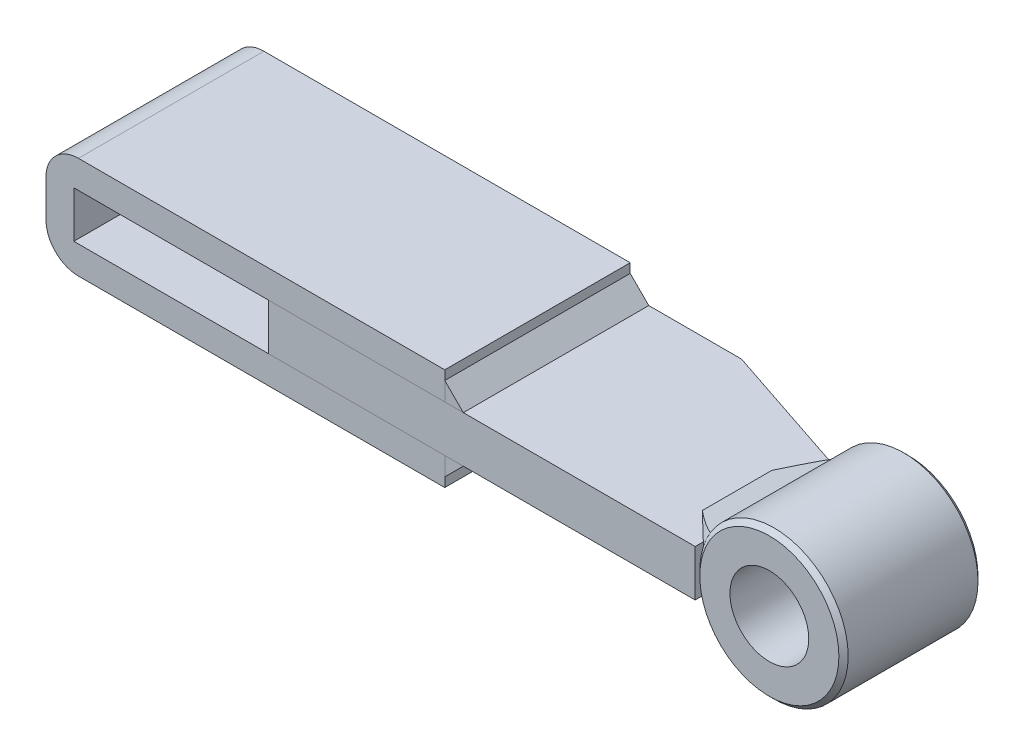
from build123d import *
from OCP.BRepAlgoAPI import BRepAlgoAPI_Cut
from OCP.TopTools import TopTools_ListOfShape

# Parameters (mm, degrees)
P_IDAT_VYSUNUT_M1_DEPTH     = 5
VYSUNOUT_TENKOST_NN_1_DEPTH = 20
ZAOBLIT1_R                  = 3.5
SKICA3_R                    = 8
P_IDAT_VYSUNUT_M2_DEPTH     = 15
SKICA7_W                    = 4.25
SKICA7_H                    = 15.001
ZKOSEN_1_SIZE               = 0.5
KOUTOV_START                = -20
KOUTOV_SVAR_1_DEPTH         = 20
KOUTOV_SVAR_1_2_DEPTH       = 20
KOUTOV_START_2              = -12.784168981
KOUTOV_SVAR_2_DEPTH         = 10.568338072
KOUTOV_START_3              = -14.500001194
KOUTOV_SVAR_2_2_DEPTH       = 14.000001194
KOUTOV_SVAR_2_3_ANGLE       = 14.364836
KOUTOV_START_4              = -11.243553316
KOUTOV_SVAR_5_DEPTH         = 7.487106972
KOUTOV_START_5              = -14.500007293
KOUTOV_SVAR_5_2_DEPTH       = 14.000007293
KOUTOV_SVAR_5_3_ANGLE       = 17.987423


with BuildPart() as part:
    # Skica1 → Přidat vysunutím1 (new body)
    with BuildSketch(Plane(origin=(0, 0, 0), x_dir=(1, 0, 0), z_dir=(0, 1, 0))):
        Polygon((0, 0), (0, 20), (31, 20), (46, 15), (46, 0), align=None)
    extrude(amount=P_IDAT_VYSUNUT_M1_DEPTH)


with BuildPart() as body_2:
    # Skica2 → Vysunout tenkostěnný1 (new body)
    with BuildSketch(Plane.XY):
        Polygon((19, 5), (-21, 5), (-21, 0), (19, 0), (19, -3), (-24, -3), (-24, 8), (19, 8), align=None)
    extrude(amount=-VYSUNOUT_TENKOST_NN_1_DEPTH)

    # Zaoblit1
    zaoblit1_edges = [body_2.edges().sort_by_distance(p)[0] for p in [
        (-24, -3, -10),
        (-24, 8, -10),
    ]]
    fillet(zaoblit1_edges, radius=ZAOBLIT1_R)


with BuildPart() as body_3:
    # Skica3 → Přidat vysunutím2 (new body)
    with BuildSketch(Plane.XY):
        with Locations((54, 2.5)):
            Circle(SKICA3_R)
    extrude(amount=-P_IDAT_VYSUNUT_M2_DEPTH)

    # Skica7 → M10 závit1 (revolve, cut)
    with BuildSketch(Plane(origin=(54, 2.5, 0), x_dir=(0, -1, 0), z_dir=(1, 0, 0))):
        with Locations((2.125, 7.5005)):
            Rectangle(SKICA7_W, SKICA7_H)
    revolve(axis=Axis((54, 2.5, 6.35), (0, 0, -1)), mode=Mode.SUBTRACT)

    # Zkosení1
    zkosen_1_edges = [body_3.edges().sort_by_distance(p)[0] for p in [
        (46, 2.5, 0),
        (46, 2.5, -15),
    ]]
    chamfer(zkosen_1_edges, length=ZKOSEN_1_SIZE)


with BuildPart() as body_4:
    # Koutový svar...1: read off the stored shape, not the designer's step
    # Koutový svar...1 outline → Koutový svar...1 (new body)
    with BuildSketch(Plane.XY.offset(KOUTOV_START)):
        Polygon((19, -2), (21, 0), (19, 0), align=None)
    extrude(amount=KOUTOV_SVAR_1_DEPTH)


with BuildPart() as body_5:
    # Koutov_ svar...1 2 outline → Koutov_ svar...1 2 (new body)
    with BuildSketch(Plane.XY.offset(KOUTOV_START)):
        Polygon((19, 5), (21, 5), (19, 7), align=None)
    extrude(amount=KOUTOV_SVAR_1_2_DEPTH)


with BuildPart() as body_6:
    # Koutový svar...2: read off the stored shape, not the designer's step
    # Koutový svar...2 outline → Koutový svar...2 (new body)
    with BuildSketch(Plane.XY.offset(KOUTOV_START_2)):
        with BuildLine():
            Line((44.611317009, 0), (47.021769698, -1.412071299))
            ThreePointArc((47.021769698, -1.412071299), (46.677098222, -0.721041686), (46.400657923, 0))
            Line((46.400657923, 0), (44.611317009, 0))
        make_face()
    extrude(amount=KOUTOV_SVAR_2_DEPTH)


with BuildPart() as koutov_svar_2_2_tool:
    # Koutov_ svar...2 2 outline → Koutov_ svar...2 2 (new body)
    with BuildSketch(Plane.XY.offset(KOUTOV_START_3)):
        with BuildLine():
            Line((44.611317009, 0), (47.021769698, -1.412071299))
            ThreePointArc((47.021769698, -1.412071299), (46.677098222, -0.721041686), (46.400657923, 0))
            Line((46.400657923, 0), (44.611317009, 0))
        make_face()
    extrude(amount=KOUTOV_SVAR_2_2_DEPTH)


with BuildPart() as body_6_1:
    add(body_6.part)


with BuildPart() as body_6_2:
    # Koutov_ svar...2 2: joined with koutov_svar_2_2_tool
    add(body_6_1.part.fuse(koutov_svar_2_2_tool.part, tol=0.00001))


with BuildPart() as koutov_svar_2_3_tool:
    # Koutov_ svar...2 3 outline → Koutov_ svar...2 3 (revolve)
    with BuildSketch(Plane(origin=(54, 2.5, 0), x_dir=(-0.9663283779143345, -0.25731200134749094, 0), z_dir=(-0.25731200134749094, 0.9663283779143345, 0))):
        Polygon((9.715830813, -12.784169187), (7.999999947, -14.500000053), (9.715830809, -14.500001194), align=None)
        Polygon((7.999999779, -0.499999779), (9.715830809, -2.215830809), (9.715830813, -0.499999779), align=None)
    revolve(axis=Axis((54, 2.5, 0), (0, 0, 1)), revolution_arc=KOUTOV_SVAR_2_3_ANGLE)


with BuildPart() as body_6_3:
    add(body_6_2.part)

    # Koutov_ svar...2 3: cut by koutov_svar_2_3_tool, with a tolerance
    koutov_svar_2_3_stock = TopTools_ListOfShape()
    koutov_svar_2_3_stock.Append(body_6_3.part.wrapped)
    koutov_svar_2_3_tools = TopTools_ListOfShape()
    koutov_svar_2_3_tools.Append(koutov_svar_2_3_tool.part.wrapped)
    koutov_svar_2_3_cut = BRepAlgoAPI_Cut()
    koutov_svar_2_3_cut.SetArguments(koutov_svar_2_3_stock)
    koutov_svar_2_3_cut.SetTools(koutov_svar_2_3_tools)
    koutov_svar_2_3_cut.SetFuzzyValue(0.00001)
    koutov_svar_2_3_cut.Build()
    add(Compound.cast(koutov_svar_2_3_cut.Shape()).solids(), mode=Mode.REPLACE)


with BuildPart() as body_7:
    # Koutový svar...5: read off the stored shape, not the designer's step
    # Koutový svar...5 outline → Koutový svar...5 (new body)
    with BuildSketch(Plane.XY.offset(KOUTOV_START_4)):
        with BuildLine():
            Line((47.129717825, 6.598685501), (43.024683777, 5))
            Line((43.024683777, 5), (46.400657923, 5))
            ThreePointArc((46.400657923, 5), (46.721163875, 5.819419327), (47.129717825, 6.598685501))
        make_face()
    extrude(amount=KOUTOV_SVAR_5_DEPTH)


with BuildPart() as koutov_svar_5_2_tool:
    # Koutov_ svar...5 2 outline → Koutov_ svar...5 2 (new body)
    with BuildSketch(Plane.XY.offset(KOUTOV_START_5)):
        with BuildLine():
            Line((47.129717825, 6.598685501), (43.024683777, 5))
            Line((43.024683777, 5), (46.400657923, 5))
            ThreePointArc((46.400657923, 5), (46.721163875, 5.819419327), (47.129717825, 6.598685501))
        make_face()
    extrude(amount=KOUTOV_SVAR_5_2_DEPTH)


with BuildPart() as body_7_1:
    add(body_7.part)


with BuildPart() as body_7_2:
    # Koutov_ svar...5 2: joined with koutov_svar_5_2_tool
    add(body_7_1.part.fuse(koutov_svar_5_2_tool.part, tol=0.00001))


with BuildPart() as koutov_svar_5_3_tool:
    # Koutov_ svar...5 3 outline → Koutov_ svar...5 3 (revolve)
    with BuildSketch(Plane(origin=(54, 2.5, 0), x_dir=(-0.8587852718698237, 0.512335687630164, 0), z_dir=(0.512335687630164, 0.8587852718698237, 0))):
        Polygon((11.256445566, -11.243554434), (7.999999649, -14.500000351), (11.25644554, -14.500007293), align=None)
        Polygon((7.999999774, -0.499999774), (11.256445558, -3.756445558), (11.256445566, -0.499999774), align=None)
    revolve(axis=Axis((54, 2.5, 0), (0, 0, 1)), revolution_arc=KOUTOV_SVAR_5_3_ANGLE)


with BuildPart() as body_7_3:
    add(body_7_2.part)

    # Koutov_ svar...5 3: cut by koutov_svar_5_3_tool, with a tolerance
    koutov_svar_5_3_stock = TopTools_ListOfShape()
    koutov_svar_5_3_stock.Append(body_7_3.part.wrapped)
    koutov_svar_5_3_tools = TopTools_ListOfShape()
    koutov_svar_5_3_tools.Append(koutov_svar_5_3_tool.part.wrapped)
    koutov_svar_5_3_cut = BRepAlgoAPI_Cut()
    koutov_svar_5_3_cut.SetArguments(koutov_svar_5_3_stock)
    koutov_svar_5_3_cut.SetTools(koutov_svar_5_3_tools)
    koutov_svar_5_3_cut.SetFuzzyValue(0.00001)
    koutov_svar_5_3_cut.Build()
    add(Compound.cast(koutov_svar_5_3_cut.Shape()).solids(), mode=Mode.REPLACE)


solid = Compound([part.part, body_2.part, body_3.part, body_4.part, body_5.part, body_6_3.part, body_7_3.part])
